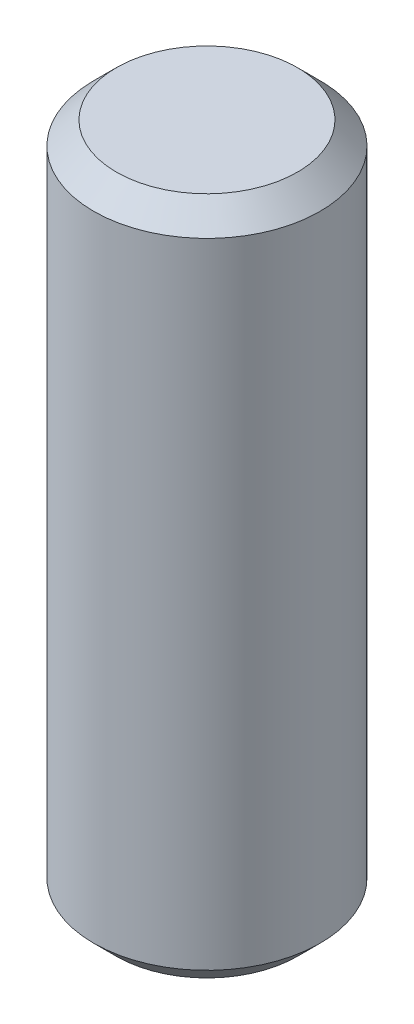
from build123d import *

# Parameters (mm, degrees)
SKETCH1_R           = 2
BOSS_EXTRUDE1_DEPTH = 12
CHAMFER1_SIZE       = 0.4


with BuildPart() as part:
    # Sketch1 → Boss-Extrude1 (new body)
    with BuildSketch(Plane(origin=(0, 0, 0), x_dir=(1, 0, 0), z_dir=(0, 1, 0))):
        Circle(SKETCH1_R)
    extrude(amount=BOSS_EXTRUDE1_DEPTH)

    # Chamfer1
    chamfer1_edges = [part.edges().sort_by_distance(p)[0] for p in [
        (-2, 0, 0),
        (-2, 12, 0),
    ]]
    chamfer(chamfer1_edges, length=CHAMFER1_SIZE)


solid = part.part
